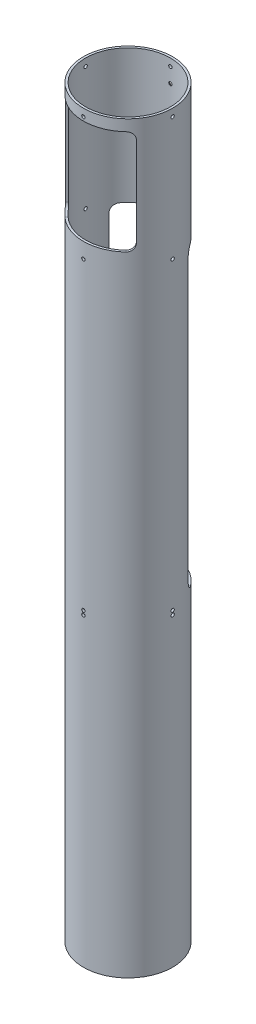
from build123d import *

# Parameters (mm, degrees)
SKETCH1_W                      = 3
SKETCH1_H                      = 1000
CUT_EXTRUDE1_START             = -15
CUT_EXTRUDE1_DEPTH             = 140
CUT_EXTRUDE2_START             = -180
CUT_EXTRUDE2_DEPTH             = 400
M4_CLEARANCE_HOLE1_D           = 4.5
M4_CLEARANCE_HOLE1_ON_FACE_2_D = 4.5
M4_CLEARANCE_HOLE1_ON_FACE_3_D = 4.5
M4_CLEARANCE_HOLE1_ON_FACE_4_D = 4.5
M4_CLEARANCE_HOLE1_ON_FACE_5_D = 4.5
M4_CLEARANCE_HOLE2_D           = 4.5
M4_CLEARANCE_HOLE2_ON_FACE_2_D = 4.5
M4_CLEARANCE_HOLE2_ON_FACE_3_D = 4.5
M4_CLEARANCE_HOLE2_ON_FACE_4_D = 4.5
FILLET1_R                      = 10


# Read off the part's stored shape, not the designer's step: CSK for M4 Hex Socket Countersunk Cap Screw1
with BuildPart() as part:
    # Sketch1 → Revolve1 (revolve)
    with BuildSketch(Plane.XY, mode=Mode.PRIVATE) as revolve1_sk:
        with Locations((58.5, 0)):
            Rectangle(SKETCH1_W, SKETCH1_H)
    revolve(revolve1_sk.sketch.rotate(Axis((0, 0, 0), (0, 1, 0)), 90), axis=Axis((0, 0, 0), (0, 1, 0)))

    # Sketch4 → Cut-Extrude1 (cut)
    with BuildSketch(Plane(origin=(0, 500, 0), x_dir=(1, 0, 0), z_dir=(0, 1, 0)).offset(CUT_EXTRUDE1_START)):
        with BuildLine():
            Line((-47.704446333, -36.390737834), (-45.562994128, -34.249285629))
            ThreePointArc((-45.562994128, -34.249285629), (0, -57), (45.562994128, -34.249285629))
            Line((45.562994128, -34.249285629), (47.704446333, -36.390737834))
            ThreePointArc((47.704446333, -36.390737834), (0, -60), (-47.704446333, -36.390737834))
        make_face()
    extrude(amount=-CUT_EXTRUDE1_DEPTH, mode=Mode.SUBTRACT)

    # Sketch6 → Cut-Extrude2 (cut)
    with BuildSketch(Plane(origin=(0, 500, 0), x_dir=(1, 0, 0), z_dir=(0, 1, 0)).offset(CUT_EXTRUDE2_START)):
        with BuildLine():
            Line((-40.305086528, 40.305086528), (-42.426406871, 42.426406871))
            ThreePointArc((-42.426406871, 42.426406871), (-48.37354649, 35.496478699), (-53.200134751, 27.744290628))
            Line((-53.200134751, 27.744290628), (-50.970568413, 25.514724291))
            ThreePointArc((-50.970568413, 25.514724291), (-46.233105022, 33.339166156), (-40.305086528, 40.305086528))
        make_face()
        with BuildLine():
            ThreePointArc((42.426406871, 42.426406871), (0, 60), (-42.426406871, 42.426406871))
            Line((-42.426406871, 42.426406871), (-40.305086528, 40.305086528))
            ThreePointArc((-40.305086528, 40.305086528), (0, 57), (40.305086528, 40.305086528))
            Line((40.305086528, 40.305086528), (42.426406871, 42.426406871))
        make_face()
        with BuildLine():
            ThreePointArc((53.200134751, 27.744290628), (48.37354649, 35.496478699), (42.426406871, 42.426406871))
            Line((42.426406871, 42.426406871), (40.305086528, 40.305086528))
            ThreePointArc((40.305086528, 40.305086528), (46.233105022, 33.339166156), (50.970568413, 25.514724291))
            Line((50.970568413, 25.514724291), (53.200134751, 27.744290628))
        make_face()
    extrude(amount=-CUT_EXTRUDE2_DEPTH, mode=Mode.SUBTRACT)

    # M4 Clearance Hole1 (through all)
    with Locations(Plane(origin=(0, 490, 60), x_dir=(1, 0, 0), z_dir=(0, 0, 1))):
        with Locations((0, 0), (0, -165.5), (0, -574.5)):
            Hole(M4_CLEARANCE_HOLE1_D / 2)

    # M4 Clearance Hole1 on face 2 (through all)
    with Locations(Plane(origin=(60, 490, 0), x_dir=(0, 0, 1), z_dir=(1, 0, 0))):
        with Locations((0, 0), (0, 165.5), (0, 574.5)):
            Hole(M4_CLEARANCE_HOLE1_ON_FACE_2_D / 2)

    # M4 Clearance Hole1 on face 3 (through all)
    with Locations(Plane(origin=(0, 490, -60), x_dir=(-1, 0, 0), z_dir=(0, 0, -1))):
        with Locations((0, 0), (0, -165.5), (0, -574.5)):
            Hole(M4_CLEARANCE_HOLE1_ON_FACE_3_D / 2)

    # M4 Clearance Hole1 on face 4 (through all)
    with Locations(Plane(origin=(-60, 490, 0), x_dir=(0, 0, -1), z_dir=(-1, 0, 0))):
        with Locations((0, 0), (0, 165.5), (0, 574.5)):
            Hole(M4_CLEARANCE_HOLE1_ON_FACE_4_D / 2)

    # M4 Clearance Hole1 on face 5 (through all)
    with Locations(Plane(origin=(0, 324.5, 0), x_dir=(1, 0, 0), z_dir=(0, 0, 1))):
        with Locations((0, 0)):
            Hole(M4_CLEARANCE_HOLE1_ON_FACE_5_D / 2)

    # M4 Clearance Hole2 (through all)
    with Locations(Plane(origin=(-60, -90, 0), x_dir=(0, 0, -1), z_dir=(-1, 0, 0))):
        with Locations((0, 0)):
            Hole(M4_CLEARANCE_HOLE2_D / 2)

    # M4 Clearance Hole2 on face 2 (through all)
    with Locations(Plane(origin=(0, -90, 60), x_dir=(1, 0, 0), z_dir=(0, 0, 1))):
        with Locations((0, 0)):
            Hole(M4_CLEARANCE_HOLE2_ON_FACE_2_D / 2)

    # M4 Clearance Hole2 on face 3 (through all)
    with Locations(Plane(origin=(60, -90, 0), x_dir=(0, 0, 1), z_dir=(1, 0, 0))):
        with Locations((0, 0)):
            Hole(M4_CLEARANCE_HOLE2_ON_FACE_3_D / 2)

    # M4 Clearance Hole2 on face 4 (through all)
    with Locations(Plane(origin=(0, -90, -60), x_dir=(-1, 0, 0), z_dir=(0, 0, -1))):
        with Locations((0, 0)):
            Hole(M4_CLEARANCE_HOLE2_ON_FACE_4_D / 2)

    # CSK for M4 Hex Socket Countersunk Ca 2 → CSK for M4 Hex Socket Countersunk Cap Screw1 (revolve, cut)
    with BuildSketch(Plane.XZ.offset(-470)):
        Polygon((2.25, -57.77), (2.25, -56.955555783), (0, -56.955555783), (0, -60.000000574), (4.480000574, -60.000000574), align=None)
    revolve(axis=Axis((0, 470, 0), (0, 0, 1)), mode=Mode.SUBTRACT)

    # CSK for M4 Hex Socket Countersunk Ca 3 o → CSK for M4 Hex Socket Countersunk Ca 3 (revolve, cut)
    with BuildSketch(Plane.XZ.offset(-360)):
        Polygon((2.25, -57.77), (2.25, -56.955555783), (0, -56.955555783), (0, -60.000000574), (4.480000574, -60.000000574), align=None)
    revolve(axis=Axis((0, 360, 0), (0, 0, 1)), mode=Mode.SUBTRACT)

    # Fillet1
    fillet1_edges = [part.edges().sort_by_distance(p)[0] for p in [
        (-46.63372023, 485, 35.320011731),
        (46.63372023, 345, 35.320011731),
        (-46.63372023, 345, 35.320011731),
        (46.63372023, 485, 35.320011731),
        (-52.085351582, 320, -26.629507459),
        (52.085351582, -80, -26.629507459),
        (-52.085351582, -80, -26.629507459),
        (52.085351582, 320, -26.629507459),
    ]]
    fillet(fillet1_edges, radius=FILLET1_R)


solid = part.part
